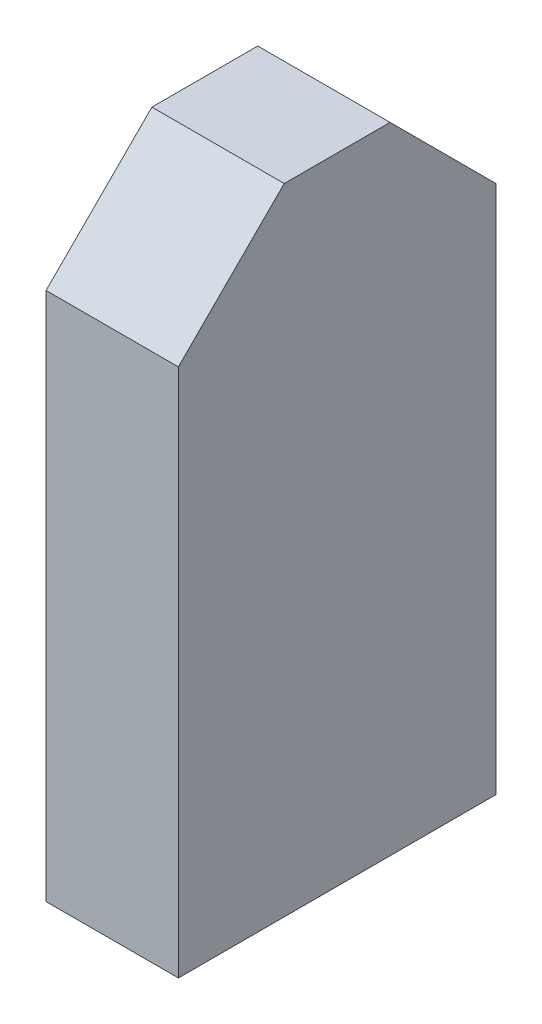
from build123d import *

# Parameters (mm, degrees)
SKETCH1_W           = 38.1
SKETCH1_H           = 76.2
BOSS_EXTRUDE1_DEPTH = 15.875
CHAMFER1_SIZE       = 12.7


with BuildPart() as part:
    # Sketch1 → Boss-Extrude1 (new body)
    with BuildSketch(Plane(origin=(0, 0, 0), x_dir=(0, 0, -1), z_dir=(1, 0, 0))):
        Rectangle(SKETCH1_W, SKETCH1_H)
    extrude(amount=BOSS_EXTRUDE1_DEPTH)

    # Chamfer1
    chamfer1_edges = [part.edges().sort_by_distance(p)[0] for p in [
        (7.9375, 38.1, -19.05),
        (7.9375, 38.1, 19.05),
    ]]
    chamfer(chamfer1_edges, length=CHAMFER1_SIZE)


solid = part.part
